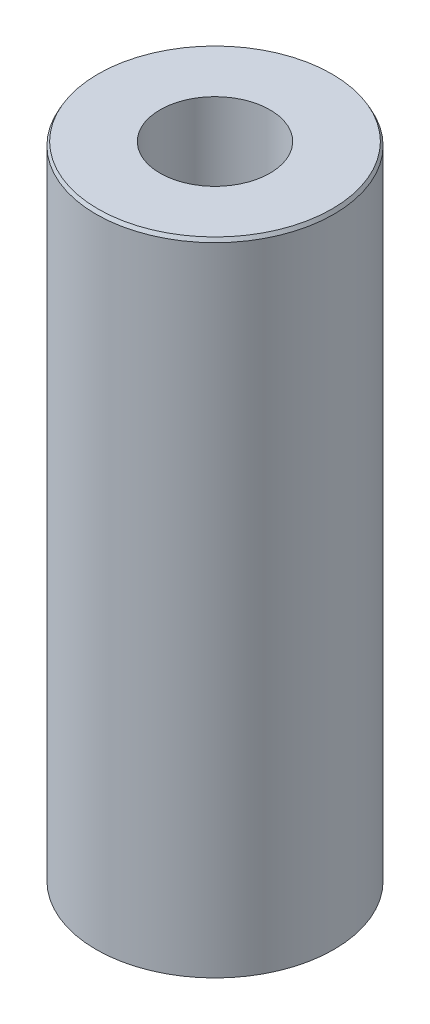
from build123d import *
from OCP.BRepFilletAPI import BRepFilletAPI_MakeChamfer

# Parameters (mm, degrees)
SKETCH1_R           = 27.5
BOSS_EXTRUDE1_DEPTH = 148.589181167
SKETCH2_R           = 12.715999643
CUT_EXTRUDE1_DEPTH  = 154.594416434
CHAMFER1_SIZE       = 0.831548345
CHAMFER1_SIZE2      = 0.443385724


with BuildPart() as part:
    # Sketch1 → Boss-Extrude1 (new body)
    with BuildSketch(Plane(origin=(0, 0, 0), x_dir=(1, 0, 0), z_dir=(0, 1, 0))):
        Circle(SKETCH1_R)
    extrude(amount=BOSS_EXTRUDE1_DEPTH)

    # Sketch2 → Cut-Extrude1 (cut, through all)
    with BuildSketch(Plane(origin=(0, 0, 0), x_dir=(1, 0, 0), z_dir=(0, 1, 0))):
        Circle(SKETCH2_R)
    extrude(amount=CUT_EXTRUDE1_DEPTH, mode=Mode.SUBTRACT)

    # Chamfer1: one chamfer whose edges measure the first distance from different faces: ONE call of the kernel's chamfer builder (chamfer() names one face for all edges)
    chamfer1_edges_1 = [part.edges().sort_by_distance(p)[0] for p in [
        (-27.5, 148.589181167, 0),
    ]]
    chamfer1_side_1 = [part.faces().sort_by_distance(p)[0] for p in [
        (-27.5, 74.294590583, 0),
    ]]
    chamfer1_edges_2 = [part.edges().sort_by_distance(p)[0] for p in [
        (-27.5, 0, 0),
    ]]
    chamfer1_side_2 = [part.faces().sort_by_distance(p)[0] for p in [
        (-26.722182541, 0, 0),
    ]]
    chamfer1 = BRepFilletAPI_MakeChamfer(part.part.solid().wrapped)
    for e in chamfer1_edges_1:
        chamfer1.Add(CHAMFER1_SIZE, CHAMFER1_SIZE2, e.wrapped, chamfer1_side_1[0].wrapped)  # the first distance lies on this face
    for e in chamfer1_edges_2:
        chamfer1.Add(CHAMFER1_SIZE, CHAMFER1_SIZE2, e.wrapped, chamfer1_side_2[0].wrapped)  # the first distance lies on this face
    add(Compound.cast(chamfer1.Shape()), mode=Mode.REPLACE)


solid = part.part
